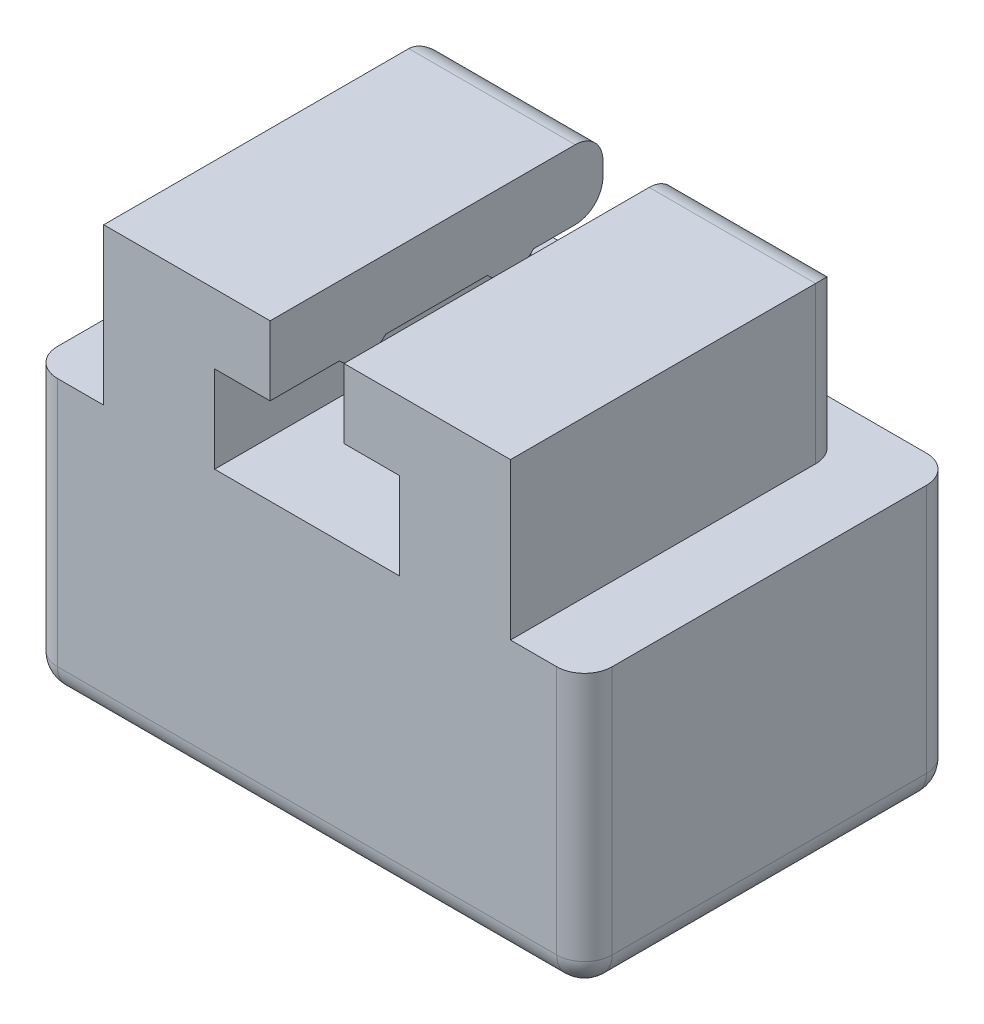
from build123d import *

# Parameters (mm, degrees)
SKETCH1_W            = 30
SKETCH1_H            = 20
BOSS_EXTRUDE1_DEPTH  = 15
BOSS_EXTRUDE2_DEPTH  = 18
SKETCH3_W            = 2.5
SKETCH3_H            = 0.5
BOSS_EXTRUDE3_DEPTH  = 3
FILLET1_R            = 1.5
FILLET1_OF_MIRROR1_R = 1.5
MIRROR2_START        = 5
MIRROR2_OUTLINE_W    = 8.45
MIRROR2_OUTLINE_H    = 18
MIRROR2_DEPTH        = 6
MIRROR2_START_2      = 2
MIRROR2_2_DEPTH      = 3
FILLET2_R            = 1.5


# Read off the part's stored shape, not the designer's step: Mirror2
with BuildPart() as part:
    # Sketch1 → Boss-Extrude1 (new body)
    with BuildSketch(Plane(origin=(0, 0, 0), x_dir=(1, 0, 0), z_dir=(0, 1, 0))):
        Rectangle(SKETCH1_W, SKETCH1_H)
    extrude(amount=BOSS_EXTRUDE1_DEPTH)

    # Sketch2 → Boss-Extrude2 (add)
    with BuildSketch(Plane.XY.offset(10)):
        Polygon((-11, 15), (-11, 23.45), (-2, 23.45), (-2, 19.7), (-5, 19.7), (-5, 15), align=None)
    extrude(amount=-BOSS_EXTRUDE2_DEPTH)

    # Sketch3 → Boss-Extrude3 (add)
    with BuildSketch(Plane(origin=(-5, 0, 0), x_dir=(0, 0, -1), z_dir=(1, 0, 0))):
        with Locations((-5, 19.45)):
            Rectangle(SKETCH3_W, SKETCH3_H)
    boss_extrude3 = extrude(amount=BOSS_EXTRUDE3_DEPTH)

    # Fillet1
    # the kernel refuses this fillet: 1.5 mm, written as the material it takes off along each edge
    with BuildSketch(Plane(origin=(-5, 19.2, 3.75), x_dir=(0, 1, 0), z_dir=(1, 0, 0))) as fillet1_piece_1:
        with BuildLine():
            CenterArc((1.5, 1.118033989), FILLET1_R, 180, 48.189685104)
            Line((0, 1.118033989), (-0.03, 1.118033989))
            Line((-0.03, 1.118033989), (-0.03, 0))
            Line((-0.03, 0), (0, -0.03))
            ThreePointArc((0, -0.03), (0.25, -0.03), (0.48, -0.02236068))
            Line((0.48, -0.02236068), (0.5, 0))
        make_face()
    extrude(amount=5.795084972, mode=Mode.SUBTRACT)
    with BuildSketch(Plane(origin=(-5, 19.2, 6.25), x_dir=(0, 1, 0), z_dir=(1, 0, 0))) as fillet1_piece_2:
        with BuildLine():
            CenterArc((1.5, -1.118033989), FILLET1_R, 131.810314896, 48.189685104)
            Line((0, -1.118033989), (-0.03, -1.118033989))
            Line((-0.03, -1.118033989), (-0.03, 0))
            Line((-0.03, 0), (0, 0.03))
            ThreePointArc((0, 0.03), (0.25, 0.03), (0.48, 0.02236068))
            Line((0.48, 0.02236068), (0.5, 0))
        make_face()
    extrude(amount=5.795084972, mode=Mode.SUBTRACT)

    # Mirror1: Boss-Extrude3 across plane
    add(boss_extrude3.mirror(Plane(origin=(0, 0, 1), x_dir=(1, 0, 0), z_dir=(0, 0, -1))))

    # Fillet1 of Mirror1
    # the kernel refuses this fillet: 1.5 mm, written as the material it takes off along each edge
    with BuildSketch(Plane(origin=(-5, 19.2, -1.75), x_dir=(0, 0, -1), z_dir=(1, 0, 0))) as fillet1_of_mirror1_piece_1:
        with BuildLine():
            CenterArc((1.118033989, 1.5), FILLET1_OF_MIRROR1_R, 221.810314896, 48.189685104)
            Line((0, 0.5), (-0.02236068, 0.48))
            ThreePointArc((-0.02236068, 0.48), (-0.03, 0.25), (-0.03, 0))
            Line((-0.03, 0), (0, -0.03))
            Line((0, -0.03), (1.118033989, -0.03))
            Line((1.118033989, -0.03), (1.118033989, 0))
        make_face()
    extrude(amount=5.795084972, mode=Mode.SUBTRACT)
    with BuildSketch(Plane(origin=(-5, 19.2, -4.25), x_dir=(0, 1, 0), z_dir=(1, 0, 0))) as fillet1_of_mirror1_piece_2:
        with BuildLine():
            CenterArc((1.5, 1.118033989), FILLET1_OF_MIRROR1_R, 180, 48.189685104)
            Line((0, 1.118033989), (-0.03, 1.118033989))
            Line((-0.03, 1.118033989), (-0.03, 0))
            Line((-0.03, 0), (0, -0.03))
            ThreePointArc((0, -0.03), (0.25, -0.03), (0.48, -0.02236068))
            Line((0.48, -0.02236068), (0.5, 0))
        make_face()
    extrude(amount=5.795084972, mode=Mode.SUBTRACT)

    # Mirror2 outline → Mirror2 (add)
    with BuildSketch(Plane.YZ.offset(MIRROR2_START)):
        with Locations((19.225, 1)):
            Rectangle(MIRROR2_OUTLINE_W, MIRROR2_OUTLINE_H)
    extrude(amount=MIRROR2_DEPTH)

    # Mirror2 2 outline → Mirror2 2 (add)
    with BuildSketch(Plane.YZ.offset(MIRROR2_START_2)):
        with BuildLine():
            Line((19.7, -4.25), (19.7, -8))
            Line((19.7, -8), (23.45, -8))
            Line((23.45, -8), (23.45, 10))
            Line((23.45, 10), (19.7, 10))
            Line((19.7, 10), (19.7, 6.25))
            ThreePointArc((19.7, 6.25), (19.330693606, 5.744338447), (19.2, 5.131966011))
            Line((19.2, 5.131966011), (19.2, 4.868033989))
            ThreePointArc((19.2, 4.868033989), (19.330693606, 4.255661553), (19.7, 3.75))
            Line((19.7, 3.75), (19.7, -1.75))
            ThreePointArc((19.7, -1.75), (19.330693606, -2.255661553), (19.2, -2.868033989))
            Line((19.2, -2.868033989), (19.2, -3.131966011))
            ThreePointArc((19.2, -3.131966011), (19.330693606, -3.744338447), (19.7, -4.25))
        make_face()
    extrude(amount=MIRROR2_2_DEPTH)

    # Fillet2
    fillet2_edges = [part.edges().sort_by_distance(p)[0] for p in [
        (-11, 19.225, -8),
        (-6.5, 23.45, -8),
        (-3.5, 19.7, -8),
        (-5, 17.35, -8),
        (0, 0, -10),
        (15, 0, 0),
        (0, 0, 10),
        (-15, 0, 0),
        (-15, 7.5, -10),
        (15, 7.5, -10),
        (15, 7.5, 10),
        (-15, 7.5, 10),
        (5, 17.35, -8),
        (3.5, 19.7, -8),
        (6.5, 23.45, -8),
        (11, 19.225, -8),
    ]]
    fillet(fillet2_edges, radius=FILLET2_R)


solid = part.part
